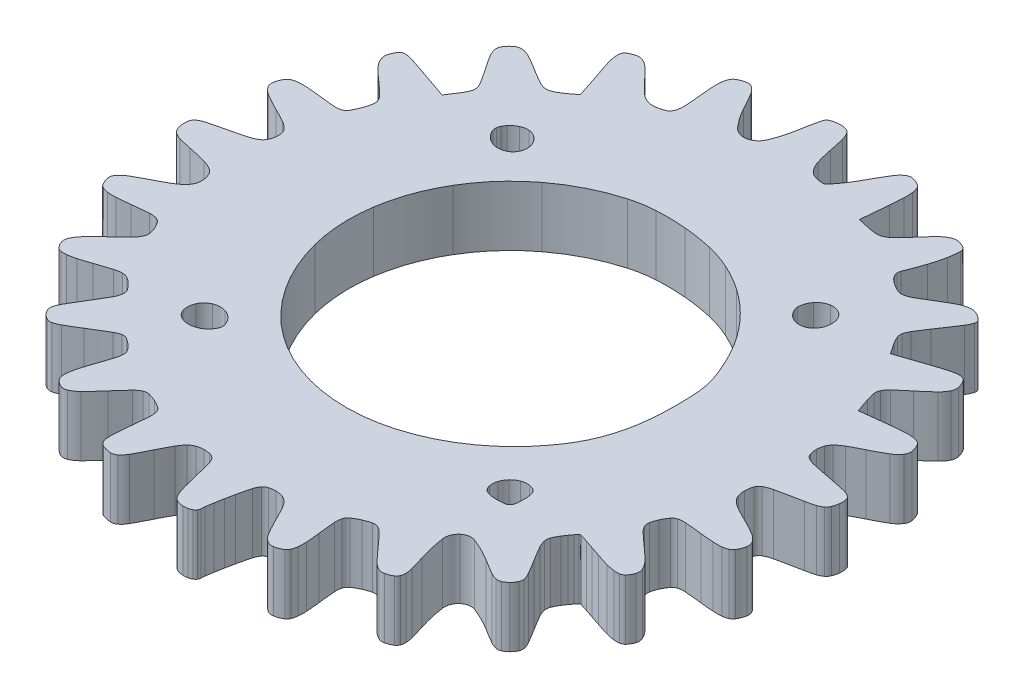
from build123d import *

# Parameters (mm, degrees)
BOSS_EXTRUDE1_DEPTH = 1
SCALE1_SCALE        = 2.27
SCALE2_SCALE        = 10


with BuildPart() as part:
    # Sketch1 → Boss-Extrude1 (new body)
    with BuildSketch(Plane(origin=(0, 0, 0), x_dir=(1, 0, 0), z_dir=(0, 1, 0))):
        with BuildLine():
            Line((11035.177669211, 9201.866790944), (11035.057855683, 9201.683932432))
            Line((11035.057855683, 9201.683932432), (11034.626065488, 9201.832489971))
            ThreePointArc((11034.626065488, 9201.832489971), (11034.448731234, 9201.892544533), (11034.270824441, 9201.950881149))
            ThreePointArc((11034.270824441, 9201.950881149), (11034.210556879, 9201.965043925), (11034.148792274, 9201.969274381))
            ThreePointArc((11034.148792274, 9201.969274381), (11034.109867467, 9201.959348395), (11034.079757284, 9201.932758122))
            ThreePointArc((11034.079757284, 9201.932758122), (11034.048985142, 9201.880804452), (11034.026412255, 9201.824799334))
            ThreePointArc((11034.026412255, 9201.824799334), (11034.017950195, 9201.779045136), (11034.021020038, 9201.732616384))
            ThreePointArc((11034.021020038, 9201.732616384), (11034.035379997, 9201.68363181), (11034.058704291, 9201.638226148))
            ThreePointArc((11034.058704291, 9201.638226148), (11034.101246113, 9201.57918784), (11034.150031591, 9201.525194269))
            ThreePointArc((11034.150031591, 9201.525194269), (11034.233485786, 9201.444903443), (11034.319274229, 9201.367111654))
            ThreePointArc((11034.319274229, 9201.367111654), (11034.424924938, 9201.272210614), (11034.528644855, 9201.175203097))
            ThreePointArc((11034.528644855, 9201.175203097), (11034.569364531, 9201.12854551), (11034.600943338, 9201.075274493))
            ThreePointArc((11034.600943338, 9201.075274493), (11034.615010663, 9201.02790222), (11034.613933686, 9200.97849714))
            ThreePointArc((11034.613933686, 9200.97849714), (11034.597141234, 9200.904446039), (11034.573620228, 9200.83224968))
            ThreePointArc((11034.573620228, 9200.83224968), (11034.543163619, 9200.759927247), (11034.507351298, 9200.690101628))
            ThreePointArc((11034.507351298, 9200.690101628), (11034.479051504, 9200.656142185), (11034.440464691, 9200.634574155))
            ThreePointArc((11034.440464691, 9200.634574155), (11034.386898194, 9200.622376539), (11034.331970064, 9200.62135094))
            ThreePointArc((11034.331970064, 9200.62135094), (11034.184748238, 9200.634910385), (11034.037759044, 9200.650794392))
            ThreePointArc((11034.037759044, 9200.650794392), (11033.926384526, 9200.662402746), (11033.814769041, 9200.671403901))
            ThreePointArc((11033.814769041, 9200.671403901), (11033.743563625, 9200.673286423), (11033.672454187, 9200.66913878))
            ThreePointArc((11033.672454187, 9200.66913878), (11033.625430439, 9200.660898955), (11033.580101463, 9200.645918582))
            ThreePointArc((11033.580101463, 9200.645918582), (11033.548535633, 9200.626758459), (11033.524236195, 9200.598954694))
            ThreePointArc((11033.524236195, 9200.598954694), (11033.490770858, 9200.532310943), (11033.471121671, 9200.460371887))
            ThreePointArc((11033.471121671, 9200.460371887), (11033.472769426, 9200.401432372), (11033.496724719, 9200.347555425))
            ThreePointArc((11033.496724719, 9200.347555425), (11033.55022757, 9200.286466615), (11033.615357603, 9200.23796428))
            ThreePointArc((11033.615357603, 9200.23796428), (11033.745586764, 9200.164297637), (11033.878603762, 9200.095792987))
            ThreePointArc((11033.878603762, 9200.095792987), (11033.995698245, 9200.036585968), (11034.111317038, 9199.974546595))
            ThreePointArc((11034.111317038, 9199.974546595), (11034.169621921, 9199.936796902), (11034.222095303, 9199.891288189))
            ThreePointArc((11034.222095303, 9199.891288189), (11034.252090004, 9199.852186517), (11034.270834728, 9199.806609568))
            ThreePointArc((11034.270834728, 9199.806609568), (11034.279908304, 9199.751957177), (11034.278653762, 9199.6965709))
            ThreePointArc((11034.278653762, 9199.6965709), (11034.266995154, 9199.641558569), (11034.245405111, 9199.589634106))
            ThreePointArc((11034.245405111, 9199.589634106), (11034.216626481, 9199.549542394), (11034.178139256, 9199.518650834))
            ThreePointArc((11034.178139256, 9199.518650834), (11034.115165178, 9199.486508748), (11034.048392069, 9199.463266541))
            ThreePointArc((11034.048392069, 9199.463266541), (11033.912700534, 9199.427767161), (11033.776287507, 9199.395149913))
            ThreePointArc((11033.776287507, 9199.395149913), (11033.631014278, 9199.360767777), (11033.48633081, 9199.323982771))
            ThreePointArc((11033.48633081, 9199.323982771), (11033.427304999, 9199.303138213), (11033.372487401, 9199.272912845))
            ThreePointArc((11033.372487401, 9199.272912845), (11033.342113111, 9199.243059754), (11033.325027678, 9199.204048314))
            ThreePointArc((11033.325027678, 9199.204048314), (11033.317283863, 9199.148072799), (11033.319087507, 9199.091592964))
            ThreePointArc((11033.319087507, 9199.091592964), (11033.32964109, 9199.037730735), (11033.348317904, 9198.986119743))
            ThreePointArc((11033.348317904, 9198.986119743), (11033.372252283, 9198.948173269), (11033.405659699, 9198.918227753))
            ThreePointArc((11033.405659699, 9198.918227753), (11033.457107079, 9198.889468735), (11033.512577291, 9198.86954464))
            ThreePointArc((11033.512577291, 9198.86954464), (11033.617322277, 9198.843141764), (11033.722833665, 9198.819990713))
            ThreePointArc((11033.722833665, 9198.819990713), (11033.878420938, 9198.785925228), (11034.032915239, 9198.747203558))
            ThreePointArc((11034.032915239, 9198.747203558), (11034.114043101, 9198.718283798), (11034.189374337, 9198.676531106))
            ThreePointArc((11034.189374337, 9198.676531106), (11034.235371669, 9198.634675882), (11034.266908675, 9198.581075214))
            ThreePointArc((11034.266908675, 9198.581075214), (11034.287414648, 9198.511370037), (11034.294333665, 9198.439041386))
            ThreePointArc((11034.294333665, 9198.439041386), (11034.288684052, 9198.387985439), (11034.272008512, 9198.339399904))
            ThreePointArc((11034.272008512, 9198.339399904), (11034.244401044, 9198.292836978), (11034.208548619, 9198.252279834))
            ThreePointArc((11034.208548619, 9198.252279834), (11034.150593798, 9198.203821622), (11034.087574032, 9198.162162666))
            ThreePointArc((11034.087574032, 9198.162162666), (11033.98225956, 9198.102818548), (11033.875233665, 9198.046619615))
            ThreePointArc((11033.875233665, 9198.046619615), (11033.739836207, 9197.975524812), (11033.606602147, 9197.900453995))
            ThreePointArc((11033.606602147, 9197.900453995), (11033.546175806, 9197.856353493), (11033.495997695, 9197.800870577))
            ThreePointArc((11033.495997695, 9197.800870577), (11033.474163269, 9197.752680404), (11033.47358697, 9197.699777637))
            ThreePointArc((11033.47358697, 9197.699777637), (11033.493585521, 9197.632369022), (11033.525584097, 9197.569759482))
            ThreePointArc((11033.525584097, 9197.569759482), (11033.550300375, 9197.541269714), (11033.582335495, 9197.521362119))
            ThreePointArc((11033.582335495, 9197.521362119), (11033.627583563, 9197.505823562), (11033.674648214, 9197.497235599))
            ThreePointArc((11033.674648214, 9197.497235599), (11033.746050999, 9197.492780333), (11033.817572515, 9197.494477387))
            ThreePointArc((11033.817572515, 9197.494477387), (11033.931176477, 9197.503381891), (11034.044546102, 9197.514891824))
            ThreePointArc((11034.044546102, 9197.514891824), (11034.185513096, 9197.529632152), (11034.326709597, 9197.541981991))
            ThreePointArc((11034.326709597, 9197.541981991), (11034.386197718, 9197.541679886), (11034.444800852, 9197.531452447))
            ThreePointArc((11034.444800852, 9197.531452447), (11034.485421727, 9197.513280642), (11034.518021889, 9197.48299039))
            ThreePointArc((11034.518021889, 9197.48299039), (11034.554280834, 9197.430042207), (11034.584208523, 9197.373274658))
            ThreePointArc((11034.584208523, 9197.373274658), (11034.606146493, 9197.314794414), (11034.619875457, 9197.253862247))
            ThreePointArc((11034.619875457, 9197.253862247), (11034.619823798, 9197.206628842), (11034.605449197, 9197.161635863))
            ThreePointArc((11034.605449197, 9197.161635863), (11034.572291369, 9197.106799411), (11034.53076832, 9197.057990452))
            ThreePointArc((11034.53076832, 9197.057990452), (11034.431749273, 9196.960973125), (11034.330779667, 9196.865987483))
            ThreePointArc((11034.330779667, 9196.865987483), (11034.218274651, 9196.758936563), (11034.109219252, 9196.648373466))
            ThreePointArc((11034.109219252, 9196.648373466), (11034.056578625, 9196.582817939), (11034.015952509, 9196.50921032))
            ThreePointArc((11034.015952509, 9196.50921032), (11034.002391585, 9196.454084678), (11034.008780108, 9196.397676152))
            ThreePointArc((11034.008780108, 9196.397676152), (11034.034584729, 9196.338896641), (11034.074018891, 9196.28824236))
            ThreePointArc((11034.074018891, 9196.28824236), (11034.103046331, 9196.267331449), (11034.137202026, 9196.256689693))
            ThreePointArc((11034.137202026, 9196.256689693), (11034.186046996, 9196.25298533), (11034.234958853, 9196.255665565))
            ThreePointArc((11034.234958853, 9196.255665565), (11034.30605419, 9196.267156425), (11034.375994309, 9196.284331014))
            ThreePointArc((11034.375994309, 9196.284331014), (11034.479436795, 9196.315610967), (11034.58206014, 9196.349481785))
            ThreePointArc((11034.58206014, 9196.349481785), (11034.710989034, 9196.392670951), (11034.84060293, 9196.433758681))
            ThreePointArc((11034.84060293, 9196.433758681), (11034.901107304, 9196.448098927), (11034.962974415, 9196.454334509))
            ThreePointArc((11034.962974415, 9196.454334509), (11035.008190423, 9196.450067901), (11035.050840102, 9196.43445713))
            ThreePointArc((11035.050840102, 9196.43445713), (11035.100163246, 9196.404666497), (11035.145274914, 9196.368816926))
            ThreePointArc((11035.145274914, 9196.368816926), (11035.199455249, 9196.313813751), (11035.246982102, 9196.252969228))
            ThreePointArc((11035.246982102, 9196.252969228), (11035.267389768, 9196.206766744), (11035.269222291, 9196.156291163))
            ThreePointArc((11035.269222291, 9196.156291163), (11035.252643728, 9196.090021541), (11035.22426894, 9196.027881514))
            ThreePointArc((11035.22426894, 9196.027881514), (11035.136355303, 9195.877100942), (11035.046067467, 9195.727729943))
            ThreePointArc((11035.046067467, 9195.727729943), (11034.975871675, 9195.611451743), (11034.907656035, 9195.494000921))
            ThreePointArc((11034.907656035, 9195.494000921), (11034.881564429, 9195.439269489), (11034.863696712, 9195.381329467))
            ThreePointArc((11034.863696712, 9195.381329467), (11034.861076174, 9195.340263478), (11034.871709066, 9195.300511442))
            ThreePointArc((11034.871709066, 9195.300511442), (11034.896477063, 9195.256673504), (11034.928722058, 9195.218002082))
            ThreePointArc((11034.928722058, 9195.218002082), (11034.967397437, 9195.185801276), (11035.01126708, 9195.161140957))
            ThreePointArc((11035.01126708, 9195.161140957), (11035.051095995, 9195.15063584), (11035.092190794, 9195.153449633))
            ThreePointArc((11035.092190794, 9195.153449633), (11035.150247323, 9195.171678315), (11035.205047718, 9195.198131332))
            ThreePointArc((11035.205047718, 9195.198131332), (11035.322790381, 9195.267260745), (11035.439351441, 9195.338364402))
            ThreePointArc((11035.439351441, 9195.338364402), (11035.589385223, 9195.430537569), (11035.740382512, 9195.521123701))
            ThreePointArc((11035.740382512, 9195.521123701), (11035.793796237, 9195.54693133), (11035.850806142, 9195.563330424))
            ThreePointArc((11035.850806142, 9195.563330424), (11035.895098279, 9195.563691916), (11035.936462943, 9195.547852451))
            ThreePointArc((11035.936462943, 9195.547852451), (11035.997124667, 9195.506497236), (11036.053755393, 9195.459774014))
            ThreePointArc((11036.053755393, 9195.459774014), (11036.091998454, 9195.420171005), (11036.124580931, 9195.375794071))
            ThreePointArc((11036.124580931, 9195.375794071), (11036.141658802, 9195.337408436), (11036.146845733, 9195.295716634))
            ThreePointArc((11036.146845733, 9195.295716634), (11036.141349451, 9195.237045424), (11036.12774666, 9195.179708839))
            ThreePointArc((11036.12774666, 9195.179708839), (11036.085258143, 9195.047008418), (11036.040872488, 9194.914930451))
            ThreePointArc((11036.040872488, 9194.914930451), (11036.006137667, 9194.809695354), (11035.974055832, 9194.703621374))
            ThreePointArc((11035.974055832, 9194.703621374), (11035.956767931, 9194.632819882), (11035.945431912, 9194.560825317))
            ThreePointArc((11035.945431912, 9194.560825317), (11035.943069671, 9194.51032961), (11035.947552253, 9194.459977817))
            ThreePointArc((11035.947552253, 9194.459977817), (11035.959018604, 9194.421637571), (11035.980231004, 9194.387704022))
            ThreePointArc((11035.980231004, 9194.387704022), (11036.028260179, 9194.342085796), (11036.085651647, 9194.309009463))
            ThreePointArc((11036.085651647, 9194.309009463), (11036.13933231, 9194.298120739), (11036.192920444, 9194.309456071))
            ThreePointArc((11036.192920444, 9194.309456071), (11036.264503078, 9194.349260493), (11036.327307297, 9194.40183516))
            ThreePointArc((11036.327307297, 9194.40183516), (11036.4367903, 9194.51622857), (11036.542647583, 9194.633985166))
            ThreePointArc((11036.542647583, 9194.633985166), (11036.63969835, 9194.743382054), (11036.738712926, 9194.851004747))
            ThreePointArc((11036.738712926, 9194.851004747), (11036.783951053, 9194.891110578), (11036.835803842, 9194.922195206))
            ThreePointArc((11036.835803842, 9194.922195206), (11036.881013281, 9194.935083664), (11036.927934747, 9194.932188532))
            ThreePointArc((11036.927934747, 9194.932188532), (11036.998051757, 9194.91199933), (11037.065853852, 9194.885038715))
            ThreePointArc((11037.065853852, 9194.885038715), (11037.132121863, 9194.851156117), (11037.19506703, 9194.811439802))
            ThreePointArc((11037.19506703, 9194.811439802), (11037.228310008, 9194.778797379), (11037.248907435, 9194.737007794))
            ThreePointArc((11037.248907435, 9194.737007794), (11037.260763333, 9194.678388317), (11037.261922243, 9194.618593147))
            ThreePointArc((11037.261922243, 9194.618593147), (11037.249976786, 9194.466847935), (11037.23565176, 9194.315308841))
            ThreePointArc((11037.23565176, 9194.315308841), (11037.223839833, 9194.188440282), (11037.214379844, 9194.061374703))
            ThreePointArc((11037.214379844, 9194.061374703), (11037.213460311, 9193.993046244), (11037.219583999, 9193.924986533))
            ThreePointArc((11037.219583999, 9193.924986533), (11037.230306719, 9193.88355221), (11037.249958233, 9193.845531193))
            ThreePointArc((11037.249958233, 9193.845531193), (11037.275920849, 9193.817257324), (11037.30922766, 9193.798175255))
            ThreePointArc((11037.30922766, 9193.798175255), (11037.379289477, 9193.776696017), (11037.451638297, 9193.765048524))
            ThreePointArc((11037.451638297, 9193.765048524), (11037.502652916, 9193.770155123), (11037.54811245, 9193.793861649))
            ThreePointArc((11037.54811245, 9193.793861649), (11037.597691616, 9193.841960239), (11037.636830282, 9193.898878889))
            ThreePointArc((11037.636830282, 9193.898878889), (11037.709089358, 9194.033877629), (11037.778135409, 9194.170547586))
            ThreePointArc((11037.778135409, 9194.170547586), (11037.835886138, 9194.284335393), (11037.896727908, 9194.396500855))
            ThreePointArc((11037.896727908, 9194.396500855), (11037.936278516, 9194.457314433), (11037.983482141, 9194.512399455))
            ThreePointArc((11037.983482141, 9194.512399455), (11038.024927924, 9194.546125025), (11038.072891335, 9194.569676633))
            ThreePointArc((11038.072891335, 9194.569676633), (11038.12966035, 9194.584617922), (11038.188146807, 9194.589647586))
            ThreePointArc((11038.188146807, 9194.589647586), (11038.240275167, 9194.5870264), (11038.291877638, 9194.579189212))
            ThreePointArc((11038.291877638, 9194.579189212), (11038.328358812, 9194.566991558), (11038.360824846, 9194.546361109))
            ThreePointArc((11038.360824846, 9194.546361109), (11038.388090503, 9194.518016517), (11038.408039661, 9194.484121635))
            ThreePointArc((11038.408039661, 9194.484121635), (11038.42793445, 9194.432892725), (11038.44319476, 9194.380097586))
            ThreePointArc((11038.44319476, 9194.380097586), (11038.503887514, 9194.133084826), (11038.566593345, 9193.886575408))
            ThreePointArc((11038.566593345, 9193.886575408), (11038.595275406, 9193.795513672), (11038.633249752, 9193.707918869))
            ThreePointArc((11038.633249752, 9193.707918869), (11038.666017537, 9193.661891545), (11038.711442991, 9193.628294365))
            ThreePointArc((11038.711442991, 9193.628294365), (11038.769546652, 9193.606465222), (11038.831170717, 9193.599047586))
            ThreePointArc((11038.831170717, 9193.599047586), (11038.869610767, 9193.600932534), (11038.907681994, 9193.606569212))
            ThreePointArc((11038.907681994, 9193.606569212), (11038.938482048, 9193.615430405), (11038.967362596, 9193.629325656))
            ThreePointArc((11038.967362596, 9193.629325656), (11038.988206268, 9193.644975532), (11039.005075196, 9193.664845524))
            ThreePointArc((11039.005075196, 9193.664845524), (11039.01524302, 9193.686202272), (11039.018733665, 9193.709596946))
            ThreePointArc((11039.018733665, 9193.709596946), (11039.01989066, 9193.742004482), (11039.023355728, 9193.774247007))
            ThreePointArc((11039.023355728, 9193.774247007), (11039.032810926, 9193.837524726), (11039.042972199, 9193.900692906))
            ThreePointArc((11039.042972199, 9193.900692906), (11039.05585407, 9193.975171952), (11039.069656524, 9194.049485903))
            ThreePointArc((11039.069656524, 9194.049485903), (11039.085035789, 9194.127276073), (11039.101247901, 9194.204896946))
            ThreePointArc((11039.101247901, 9194.204896946), (11039.126839305, 9194.316973428), (11039.155386554, 9194.42833371))
            ThreePointArc((11039.155386554, 9194.42833371), (11039.174862623, 9194.480208818), (11039.203783612, 9194.527473187))
            ThreePointArc((11039.203783612, 9194.527473187), (11039.234609238, 9194.556772348), (11039.273325027, 9194.574372001))
            ThreePointArc((11039.273325027, 9194.574372001), (11039.33125242, 9194.585812528), (11039.39017407, 9194.589647586))
            ThreePointArc((11039.39017407, 9194.589647586), (11039.449280842, 9194.584663153), (11039.50671816, 9194.569850674))
            ThreePointArc((11039.50671816, 9194.569850674), (11039.554840995, 9194.546551872), (11039.596427505, 9194.512948247))
            ThreePointArc((11039.596427505, 9194.512948247), (11039.643621566, 9194.458064137), (11039.683108815, 9194.397398644))
            ThreePointArc((11039.683108815, 9194.397398644), (11039.744163976, 9194.284783007), (11039.80213192, 9194.170547586))
            ThreePointArc((11039.80213192, 9194.170547586), (11039.870133486, 9194.038580951), (11039.943314366, 9193.909414529))
            ThreePointArc((11039.943314366, 9193.909414529), (11039.991659912, 9193.844686232), (11040.05256543, 9193.791605519))
            ThreePointArc((11040.05256543, 9193.791605519), (11040.106392973, 9193.767846821), (11040.16521128, 9193.766334551))
            ThreePointArc((11040.16521128, 9193.766334551), (11040.237065226, 9193.786076993), (11040.303640772, 9193.819550117))
            ThreePointArc((11040.303640772, 9193.819550117), (11040.331502783, 9193.843925252), (11040.35066364, 9193.87560017))
            ThreePointArc((11040.35066364, 9193.87560017), (11040.365620353, 9193.921149982), (11040.373814571, 9193.968387081))
            ThreePointArc((11040.373814571, 9193.968387081), (11040.377891689, 9194.039976806), (11040.375931179, 9194.11165573))
            ThreePointArc((11040.375931179, 9194.11165573), (11040.366779748, 9194.224412554), (11040.355032948, 9194.33692861))
            ThreePointArc((11040.355032948, 9194.33692861), (11040.339447074, 9194.481723918), (11040.326271715, 9194.626758434))
            ThreePointArc((11040.326271715, 9194.626758434), (11040.326867295, 9194.684778707), (11040.338130111, 9194.741698438))
            ThreePointArc((11040.338130111, 9194.741698438), (11040.358232482, 9194.782600507), (11040.390755127, 9194.814527959))
            ThreePointArc((11040.390755127, 9194.814527959), (11040.452724253, 9194.853612054), (11040.517925916, 9194.887025858))
            ThreePointArc((11040.517925916, 9194.887025858), (11040.584742815, 9194.913561896), (11040.653913275, 9194.933160539))
            ThreePointArc((11040.653913275, 9194.933160539), (11040.700988348, 9194.935841318), (11040.746308518, 9194.922828581))
            ThreePointArc((11040.746308518, 9194.922828581), (11040.798723535, 9194.891491499), (11040.844601336, 9194.851185493))
            ThreePointArc((11040.844601336, 9194.851185493), (11040.944358954, 9194.744079312), (11041.042156542, 9194.635180515))
            ThreePointArc((11041.042156542, 9194.635180515), (11041.146891628, 9194.519087789), (11041.254233334, 9194.405400863))
            ThreePointArc((11041.254233334, 9194.405400863), (11041.310513248, 9194.356047396), (11041.374161466, 9194.316650723))
            ThreePointArc((11041.374161466, 9194.316650723), (11041.424305439, 9194.301035468), (11041.476788235, 9194.302987453))
            ThreePointArc((11041.476788235, 9194.302987453), (11041.53938764, 9194.322095131), (11041.597581999, 9194.352048518))
            ThreePointArc((11041.597581999, 9194.352048518), (11041.624333466, 9194.3755566), (11041.642573604, 9194.40614366))
            ThreePointArc((11041.642573604, 9194.40614366), (11041.653271014, 9194.444700029), (11041.655215031, 9194.484665627))
            ThreePointArc((11041.655215031, 9194.484665627), (11041.647955654, 9194.548184242), (11041.634219036, 9194.61062316))
            ThreePointArc((11041.634219036, 9194.61062316), (11041.601780922, 9194.724593233), (11041.567215385, 9194.837936218))
            ThreePointArc((11041.567215385, 9194.837936218), (11041.506732058, 9195.060002397), (11041.463938172, 9195.286144618))
            ThreePointArc((11041.463938172, 9195.286144618), (11041.475562914, 9195.40153403), (11041.540698395, 9195.49748829))
            ThreePointArc((11041.540698395, 9195.49748829), (11041.640030214, 9195.545684679), (11041.749911057, 9195.534918873))
            ThreePointArc((11041.749911057, 9195.534918873), (11041.946756142, 9195.447409356), (11042.134739421, 9195.342203891))
            ThreePointArc((11042.134739421, 9195.342203891), (11042.254571324, 9195.269041496), (11042.375564111, 9195.197815331))
            ThreePointArc((11042.375564111, 9195.197815331), (11042.430435674, 9195.171291025), (11042.488609402, 9195.153118392))
            ThreePointArc((11042.488609402, 9195.153118392), (11042.529976495, 9195.150538337), (11042.569909011, 9195.161641819))
            ThreePointArc((11042.569909011, 9195.161641819), (11042.614820916, 9195.187644604), (11042.654562258, 9195.221018993))
            ThreePointArc((11042.654562258, 9195.221018993), (11042.687947863, 9195.260734827), (11042.714009307, 9195.305598478))
            ThreePointArc((11042.714009307, 9195.305598478), (11042.725156241, 9195.345411641), (11042.722644596, 9195.386679469))
            ThreePointArc((11042.722644596, 9195.386679469), (11042.704611554, 9195.444622848), (11042.678226777, 9195.499271446))
            ThreePointArc((11042.678226777, 9195.499271446), (11042.60736475, 9195.619681731), (11042.534565317, 9195.738930657))
            ThreePointArc((11042.534565317, 9195.738930657), (11042.460659779, 9195.860222821), (11042.388932868, 9195.98281592))
            ThreePointArc((11042.388932868, 9195.98281592), (11042.361591026, 9196.040261258), (11042.343288382, 9196.10119201))
            ThreePointArc((11042.343288382, 9196.10119201), (11042.339743841, 9196.149100856), (11042.349741455, 9196.196088823))
            ThreePointArc((11042.349741455, 9196.196088823), (11042.375881468, 9196.256470478), (11042.408738848, 9196.313476066))
            ThreePointArc((11042.408738848, 9196.313476066), (11042.432062965, 9196.348398432), (11042.455998469, 9196.382904629))
            ThreePointArc((11042.455998469, 9196.382904629), (11042.477483042, 9196.412458257), (11042.499748089, 9196.441428439))
            ThreePointArc((11042.499748089, 9196.441428439), (11042.518631578, 9196.46494314), (11042.537888628, 9196.488152908))
            ThreePointArc((11042.537888628, 9196.488152908), (11042.54415708, 9196.492944579), (11042.551861193, 9196.494647586))
            ThreePointArc((11042.551861193, 9196.494647586), (11042.561051578, 9196.493930977), (11042.570019806, 9196.491798468))
            ThreePointArc((11042.570019806, 9196.491798468), (11042.631668261, 9196.471910205), (11042.693284736, 9196.451923084))
            ThreePointArc((11042.693284736, 9196.451923084), (11042.764316114, 9196.428617471), (11042.835227048, 9196.404947918))
            ThreePointArc((11042.835227048, 9196.404947918), (11042.917169391, 9196.377211004), (11042.999019252, 9196.34920236))
            ThreePointArc((11042.999019252, 9196.34920236), (11043.101448016, 9196.315398664), (11043.204695854, 9196.284186082))
            ThreePointArc((11043.204695854, 9196.284186082), (11043.274516861, 9196.267052845), (11043.345491585, 9196.255602547))
            ThreePointArc((11043.345491585, 9196.255602547), (11043.394333283, 9196.25294836), (11043.443104547, 9196.256679329))
            ThreePointArc((11043.443104547, 9196.256679329), (11043.477238401, 9196.267335581), (11043.506248439, 9196.28824236))
            ThreePointArc((11043.506248439, 9196.28824236), (11043.546157393, 9196.339651353), (11043.572074113, 9196.399350037))
            ThreePointArc((11043.572074113, 9196.399350037), (11043.578215207, 9196.456717405), (11043.564015582, 9196.512637873))
            ThreePointArc((11043.564015582, 9196.512637873), (11043.522302047, 9196.586388126), (11043.468264948, 9196.65164999))
            ThreePointArc((11043.468264948, 9196.65164999), (11043.358906259, 9196.758445539), (11043.245928665, 9196.86140512))
            ThreePointArc((11043.245928665, 9196.86140512), (11043.141860735, 9196.954843412), (11043.039652217, 9197.050312083))
            ThreePointArc((11043.039652217, 9197.050312083), (11042.998594745, 9197.096776862), (11042.966089651, 9197.149579423))
            ThreePointArc((11042.966089651, 9197.149579423), (11042.952158644, 9197.194055213), (11042.953141671, 9197.240651377))
            ThreePointArc((11042.953141671, 9197.240651377), (11042.969007481, 9197.304259894), (11042.992499809, 9197.365463472))
            ThreePointArc((11042.992499809, 9197.365463472), (11043.023563563, 9197.42509709), (11043.060729594, 9197.48113111))
            ThreePointArc((11043.060729594, 9197.48113111), (11043.093069474, 9197.512267293), (11043.133791678, 9197.531162582))
            ThreePointArc((11043.133791678, 9197.531162582), (11043.191804147, 9197.541813974), (11043.25078451, 9197.542278333))
            ThreePointArc((11043.25078451, 9197.542278333), (11043.393368152, 9197.52978452), (11043.535721227, 9197.514891824))
            ThreePointArc((11043.535721227, 9197.514891824), (11043.649090852, 9197.503381891), (11043.762694814, 9197.494477387))
            ThreePointArc((11043.762694814, 9197.494477387), (11043.83421633, 9197.492780333), (11043.905619116, 9197.497235599))
            ThreePointArc((11043.905619116, 9197.497235599), (11043.952683766, 9197.505823562), (11043.997931834, 9197.521362119))
            ThreePointArc((11043.997931834, 9197.521362119), (11044.029966955, 9197.541269714), (11044.054683232, 9197.569759482))
            ThreePointArc((11044.054683232, 9197.569759482), (11044.08863074, 9197.637007255), (11044.10897436, 9197.709538857))
            ThreePointArc((11044.10897436, 9197.709538857), (11044.107831382, 9197.768521122), (11044.084262167, 9197.822601674))
            ThreePointArc((11044.084262167, 9197.822601674), (11044.031430794, 9197.883573502), (11043.966838272, 9197.931911107))
            ThreePointArc((11043.966838272, 9197.931911107), (11043.837338895, 9198.005275226), (11043.705033665, 9198.073449331))
            ThreePointArc((11043.705033665, 9198.073449331), (11043.589709384, 9198.131945455), (11043.475999096, 9198.193520261))
            ThreePointArc((11043.475999096, 9198.193520261), (11043.415696774, 9198.232853866), (11043.361306133, 9198.280025473))
            ThreePointArc((11043.361306133, 9198.280025473), (11043.327992226, 9198.321967975), (11043.305300276, 9198.370486684))
            ThreePointArc((11043.305300276, 9198.370486684), (11043.290806546, 9198.429600416), (11043.285933665, 9198.490269655))
            ThreePointArc((11043.285933665, 9198.490269655), (11043.291138056, 9198.559110381), (11043.306632861, 9198.626386249))
            ThreePointArc((11043.306632861, 9198.626386249), (11043.330222199, 9198.670088293), (11043.368537513, 9198.701683583))
            ThreePointArc((11043.368537513, 9198.701683583), (11043.436899357, 9198.732659416), (11043.508956663, 9198.753649621))
            ThreePointArc((11043.508956663, 9198.753649621), (11043.721091012, 9198.79837516), (11043.933633665, 9198.841118306))
            ThreePointArc((11043.933633665, 9198.841118306), (11044.014899225, 9198.859047909), (11044.095238625, 9198.880753736))
            ThreePointArc((11044.095238625, 9198.880753736), (11044.142295619, 9198.899634395), (11044.184976926, 9198.927004926))
            ThreePointArc((11044.184976926, 9198.927004926), (11044.21457486, 9198.95724964), (11044.235280051, 9198.994155947))
            ThreePointArc((11044.235280051, 9198.994155947), (11044.251872616, 9199.045251945), (11044.261636869, 9199.098079717))
            ThreePointArc((11044.261636869, 9199.098079717), (11044.263694143, 9199.155841382), (11044.256344246, 9199.213170445))
            ThreePointArc((11044.256344246, 9199.213170445), (11044.239535945, 9199.25160827), (11044.208904031, 9199.280273079))
            ThreePointArc((11044.208904031, 9199.280273079), (11044.153318268, 9199.30821387), (11044.093868777, 9199.326550253))
            ThreePointArc((11044.093868777, 9199.326550253), (11043.939858937, 9199.359140308), (11043.785386869, 9199.389463945))
            ThreePointArc((11043.785386869, 9199.389463945), (11043.633114516, 9199.41947673), (11043.481349098, 9199.45195587))
            ThreePointArc((11043.481349098, 9199.45195587), (11043.418947055, 9199.471178308), (11043.360397524, 9199.500082799))
            ThreePointArc((11043.360397524, 9199.500082799), (11043.326318165, 9199.529813931), (11043.304810005, 9199.569597621))
            ThreePointArc((11043.304810005, 9199.569597621), (11043.290682432, 9199.627950927), (11043.285933665, 9199.687801957))
            ThreePointArc((11043.285933665, 9199.687801957), (11043.29097192, 9199.746171636), (11043.305937612, 9199.802814655))
            ThreePointArc((11043.305937612, 9199.802814655), (11043.329537584, 9199.850747868), (11043.363286571, 9199.892167156))
            ThreePointArc((11043.363286571, 9199.892167156), (11043.418409781, 9199.939372677), (11043.479251541, 9199.97893541))
            ThreePointArc((11043.479251541, 9199.97893541), (11043.591331221, 9200.039736443), (11043.705033665, 9200.097445841))
            ThreePointArc((11043.705033665, 9200.097445841), (11043.837000299, 9200.165447408), (11043.966166721, 9200.238628287))
            ThreePointArc((11043.966166721, 9200.238628287), (11044.030895018, 9200.286973833), (11044.083975731, 9200.347879351))
            ThreePointArc((11044.083975731, 9200.347879351), (11044.10773443, 9200.401706895), (11044.109246699, 9200.460525202))
            ThreePointArc((11044.109246699, 9200.460525202), (11044.089504258, 9200.532379147), (11044.056031134, 9200.598954694))
            ThreePointArc((11044.056031134, 9200.598954694), (11044.031554885, 9200.626894208), (11043.999734193, 9200.646055285))
            ThreePointArc((11043.999734193, 9200.646055285), (11043.953887185, 9200.660979944), (11043.906363056, 9200.669113253))
            ThreePointArc((11043.906363056, 9200.669113253), (11043.834128124, 9200.673095929), (11043.761812952, 9200.671031207))
            ThreePointArc((11043.761812952, 9200.671031207), (11043.6475208, 9200.661678153), (11043.533469136, 9200.64974527))
            Line((11043.533469136, 9200.64974527), (11043.076675968, 9200.596728815))
            Line((11043.076675968, 9200.596728815), (11042.995271279, 9200.830246535))
            ThreePointArc((11042.995271279, 9200.830246535), (11042.973941699, 9200.901840164), (11042.959261598, 9200.975086961))
            ThreePointArc((11042.959261598, 9200.975086961), (11042.959388078, 9201.023750692), (11042.974309574, 9201.07007049))
            ThreePointArc((11042.974309574, 9201.07007049), (11043.006364491, 9201.121227157), (11043.04737882, 9201.165525544))
            ThreePointArc((11043.04737882, 9201.165525544), (11043.148877934, 9201.254427707), (11043.252300128, 9201.341085163))
            ThreePointArc((11043.252300128, 9201.341085163), (11043.362379858, 9201.434342662), (11043.469345464, 9201.531156233))
            ThreePointArc((11043.469345464, 9201.531156233), (11043.52065565, 9201.588815962), (11043.560603194, 9201.65485817))
            ThreePointArc((11043.560603194, 9201.65485817), (11043.57673746, 9201.709384359), (11043.574365371, 9201.766198028))
            ThreePointArc((11043.574365371, 9201.766198028), (11043.553908843, 9201.8332829), (11043.521829891, 9201.895651084))
            ThreePointArc((11043.521829891, 9201.895651084), (11043.497080203, 9201.923246711), (11043.46467029, 9201.941237353))
            ThreePointArc((11043.46467029, 9201.941237353), (11043.42301603, 9201.951018584), (11043.380231546, 9201.951506065))
            ThreePointArc((11043.380231546, 9201.951506065), (11043.310801884, 9201.941240617), (11043.242694813, 9201.924291159))
            ThreePointArc((11043.242694813, 9201.924291159), (11043.115187439, 9201.884740569), (11042.988354377, 9201.84307819))
            Line((11042.988354377, 9201.84307819), (11042.521448859, 9201.685401721))
            Line((11042.521448859, 9201.685401721), (11042.402116763, 9201.867525588))
            ThreePointArc((11042.402116763, 9201.867525588), (11042.368837444, 9201.924070626), (11042.341141447, 9201.983549918))
            ThreePointArc((11042.341141447, 9201.983549918), (11042.330539305, 9202.026662261), (11042.332846848, 9202.070999095))
            ThreePointArc((11042.332846848, 9202.070999095), (11042.348559739, 9202.124275344), (11042.373381667, 9202.173965641))
            ThreePointArc((11042.373381667, 9202.173965641), (11042.437923368, 9202.276351021), (11042.504691564, 9202.377298559))
            ThreePointArc((11042.504691564, 9202.377298559), (11042.617147532, 9202.544799589), (11042.7282424, 9202.713206447))
            ThreePointArc((11042.7282424, 9202.713206447), (11042.75904493, 9202.769049506), (11042.781152327, 9202.828870122))
            ThreePointArc((11042.781152327, 9202.828870122), (11042.782185427, 9202.867736475), (11042.764293611, 9202.902255218))
            ThreePointArc((11042.764293611, 9202.902255218), (11042.722767144, 9202.941175055), (11042.675117132, 9202.972298639))
            ThreePointArc((11042.675117132, 9202.972298639), (11042.627057087, 9202.992607195), (11042.576101785, 9203.003821588))
            ThreePointArc((11042.576101785, 9203.003821588), (11042.525275802, 9203.005150697), (11042.475179609, 9202.996466307))
            ThreePointArc((11042.475179609, 9202.996466307), (11042.408685931, 9202.973839397), (11042.345224853, 9202.943738269))
            ThreePointArc((11042.345224853, 9202.943738269), (11042.240663377, 9202.884816174), (11042.137645918, 9202.82323437))
            ThreePointArc((11042.137645918, 9202.82323437), (11042.018137363, 9202.751168157), (11041.897356533, 9202.681255177))
            ThreePointArc((11041.897356533, 9202.681255177), (11041.842477625, 9202.655869478), (11041.784174616, 9202.639841773))
            ThreePointArc((11041.784174616, 9202.639841773), (11041.736678433, 9202.637896556), (11041.69060574, 9202.649600326))
            ThreePointArc((11041.69060574, 9202.649600326), (11041.626595409, 9202.679752429), (11041.565669439, 9202.715731562))
            ThreePointArc((11041.565669439, 9202.715731562), (11041.523861652, 9202.745483826), (11041.484463709, 9202.778360723))
            ThreePointArc((11041.484463709, 9202.778360723), (11041.4567581, 9202.807593273), (11041.433952863, 9202.840790621))
            ThreePointArc((11041.433952863, 9202.840790621), (11041.420643403, 9202.870691671), (11041.413846807, 9202.902707617))
            ThreePointArc((11041.413846807, 9202.902707617), (11041.414387213, 9202.933812307), (11041.422411153, 9202.96386909))
            ThreePointArc((11041.422411153, 9202.96386909), (11041.484183269, 9203.124688519), (11041.540812695, 9203.287390058))
            ThreePointArc((11041.540812695, 9203.287390058), (11041.579118995, 9203.41729303), (11041.608961936, 9203.549397358))
            ThreePointArc((11041.608961936, 9203.549397358), (11041.623665659, 9203.645881821), (11041.630874313, 9203.743213658))
            ThreePointArc((11041.630874313, 9203.743213658), (11041.620238324, 9203.789743151), (11041.587888597, 9203.824837498))
            ThreePointArc((11041.587888597, 9203.824837498), (11041.529167912, 9203.854550936), (11041.46579829, 9203.872307583))
            ThreePointArc((11041.46579829, 9203.872307583), (11041.409364867, 9203.873587499), (11041.355164272, 9203.857818382))
            ThreePointArc((11041.355164272, 9203.857818382), (11041.289038294, 9203.819590781), (11041.230640899, 9203.770359298))
            ThreePointArc((11041.230640899, 9203.770359298), (11041.138242813, 9203.67385197), (11041.049491478, 9203.573980697))
            ThreePointArc((11041.049491478, 9203.573980697), (11040.972327306, 9203.486580852), (11040.892519325, 9203.401588331))
            ThreePointArc((11040.892519325, 9203.401588331), (11040.843973437, 9203.358730038), (11040.789340106, 9203.323963163))
            ThreePointArc((11040.789340106, 9203.323963163), (11040.740623964, 9203.305076788), (11040.688833525, 9203.298169691))
            ThreePointArc((11040.688833525, 9203.298169691), (11040.621966592, 9203.301085943), (11040.555876793, 9203.311660901))
            Line((11040.555876793, 9203.311660901), (11040.329379761, 9203.361407995))
            Line((11040.329379761, 9203.361407995), (11040.371127988, 9203.821814644))
            ThreePointArc((11040.371127988, 9203.821814644), (11040.380102982, 9203.935705216), (11040.386390772, 9204.049775707))
            ThreePointArc((11040.386390772, 9204.049775707), (11040.386533027, 9204.123345154), (11040.380598353, 9204.196674981))
            ThreePointArc((11040.380598353, 9204.196674981), (11040.371131527, 9204.245416349), (11040.354980522, 9204.292368313))
            ThreePointArc((11040.354980522, 9204.292368313), (11040.335036492, 9204.324725422), (11040.30635494, 9204.349667665))
            ThreePointArc((11040.30635494, 9204.349667665), (11040.243722058, 9204.381660915), (11040.176284893, 9204.401627759))
            ThreePointArc((11040.176284893, 9204.401627759), (11040.122977492, 9204.401203866), (11040.074197162, 9204.379701818))
            ThreePointArc((11040.074197162, 9204.379701818), (11040.017298155, 9204.329912318), (11039.971434071, 9204.269804273))
            ThreePointArc((11039.971434071, 9204.269804273), (11039.891878453, 9204.136316107), (11039.81616095, 9204.000614057))
            ThreePointArc((11039.81616095, 9204.000614057), (11039.770878308, 9203.919663522), (11039.723134313, 9203.840139829))
            ThreePointArc((11039.723134313, 9203.840139829), (11039.678289261, 9203.771412719), (11039.630450805, 9203.704734563))
            ThreePointArc((11039.630450805, 9203.704734563), (11039.58990074, 9203.652846389), (11039.547418256, 9203.602528112))
            ThreePointArc((11039.547418256, 9203.602528112), (11039.52657779, 9203.587050513), (11039.501215834, 9203.581514057))
            ThreePointArc((11039.501215834, 9203.581514057), (11039.421921561, 9203.588584529), (11039.345256227, 9203.610032136))
            ThreePointArc((11039.345256227, 9203.610032136), (11039.284535304, 9203.643429378), (11039.235227694, 9203.692123996))
            ThreePointArc((11039.235227694, 9203.692123996), (11039.188025063, 9203.766911179), (11039.155054931, 9203.848973238))
            ThreePointArc((11039.155054931, 9203.848973238), (11039.117924401, 9203.984601248), (11039.08743246, 9204.121874242))
            ThreePointArc((11039.08743246, 9204.121874242), (11039.060928444, 9204.249367796), (11039.031700161, 9204.376264513))
            ThreePointArc((11039.031700161, 9204.376264513), (11039.01214321, 9204.437166786), (11038.983862106, 9204.494540476))
            ThreePointArc((11038.983862106, 9204.494540476), (11038.95635242, 9204.528024205), (11038.919884967, 9204.551435054))
            ThreePointArc((11038.919884967, 9204.551435054), (11038.872412396, 9204.566689255), (11038.822816759, 9204.571847586))
            ThreePointArc((11038.822816759, 9204.571847586), (11038.787809577, 9204.570796018), (11038.752928634, 9204.56764508))
            ThreePointArc((11038.752928634, 9204.56764508), (11038.720496531, 9204.562526076), (11038.688523098, 9204.555059812))
            ThreePointArc((11038.688523098, 9204.555059812), (11038.662676321, 9204.546913098), (11038.637553147, 9204.536751847))
            ThreePointArc((11038.637553147, 9204.536751847), (11038.623534303, 9204.527626357), (11038.612920659, 9204.514697586))
            ThreePointArc((11038.612920659, 9204.514697586), (11038.60361849, 9204.496101795), (11038.597016195, 9204.476385217))
            ThreePointArc((11038.597016195, 9204.476385217), (11038.58478632, 9204.427654878), (11038.573228002, 9204.378760901))
            ThreePointArc((11038.573228002, 9204.378760901), (11038.560287548, 9204.319969026), (11038.548360742, 9204.260963168))
            ThreePointArc((11038.548360742, 9204.260963168), (11038.536383638, 9204.196652817), (11038.525270618, 9204.132187531))
            ThreePointArc((11038.525270618, 9204.132187531), (11038.479321416, 9203.931361886), (11038.409301457, 9203.737610824))
            ThreePointArc((11038.409301457, 9203.737610824), (11038.333876605, 9203.639532674), (11038.220879279, 9203.589135886))
            ThreePointArc((11038.220879279, 9203.589135886), (11038.098731548, 9203.59903029), (11037.996617497, 9203.666784905))
            ThreePointArc((11037.996617497, 9203.666784905), (11037.870275733, 9203.826300599), (11037.764847348, 9204.000347586))
            ThreePointArc((11037.764847348, 9204.000347586), (11037.691539203, 9204.135349476), (11037.614096545, 9204.26802287))
            ThreePointArc((11037.614096545, 9204.26802287), (11037.567985175, 9204.329172756), (11037.510411357, 9204.379678425))
            ThreePointArc((11037.510411357, 9204.379678425), (11037.46054233, 9204.401654078), (11037.406048523, 9204.402177847))
            ThreePointArc((11037.406048523, 9204.402177847), (11037.337349092, 9204.381980286), (11037.273558364, 9204.349448818))
            ThreePointArc((11037.273558364, 9204.349448818), (11037.244764576, 9204.324498366), (11037.224603674, 9204.292169659))
            ThreePointArc((11037.224603674, 9204.292169659), (11037.208689217, 9204.246313349), (11037.19970822, 9204.198612061))
            ThreePointArc((11037.19970822, 9204.198612061), (11037.194674246, 9204.126325266), (11037.19580937, 9204.053872295))
            ThreePointArc((11037.19580937, 9204.053872295), (11037.203822761, 9203.939140526), (11037.214465874, 9203.824622766))
            ThreePointArc((11037.214465874, 9203.824622766), (11037.225957665, 9203.703140425), (11037.235059609, 9203.581455688))
            ThreePointArc((11037.235059609, 9203.581455688), (11037.235976954, 9203.514206045), (11037.230015931, 9203.447214834))
            ThreePointArc((11037.230015931, 9203.447214834), (11037.219618484, 9203.406155394), (11037.200656986, 9203.368281311))
            ThreePointArc((11037.200656986, 9203.368281311), (11037.175849402, 9203.340576221), (11037.143658929, 9203.321954683))
            ThreePointArc((11037.143658929, 9203.321954683), (11037.065700946, 9203.298018449), (11036.985204305, 9203.284953944))
            ThreePointArc((11036.985204305, 9203.284953944), (11036.918529501, 9203.287029306), (11036.854385974, 9203.305344455))
            ThreePointArc((11036.854385974, 9203.305344455), (11036.782656848, 9203.34344438), (11036.718569532, 9203.393339148))
            ThreePointArc((11036.718569532, 9203.393339148), (11036.623803167, 9203.485255068), (11036.533168532, 9203.581247586))
            ThreePointArc((11036.533168532, 9203.581247586), (11036.440963813, 9203.679811095), (11036.345392224, 9203.775113492))
            ThreePointArc((11036.345392224, 9203.775113492), (11036.286709344, 9203.822510247), (11036.220691153, 9203.859003139))
            ThreePointArc((11036.220691153, 9203.859003139), (11036.166863188, 9203.873623195), (11036.111129421, 9203.871399889))
            ThreePointArc((11036.111129421, 9203.871399889), (11036.047809145, 9203.852799292), (11035.989039267, 9203.822773621))
            ThreePointArc((11035.989039267, 9203.822773621), (11035.964525897, 9203.799711819), (11035.950270002, 9203.769223766))
            ThreePointArc((11035.950270002, 9203.769223766), (11035.943417075, 9203.726207208), (11035.944388734, 9203.682659042))
            ThreePointArc((11035.944388734, 9203.682659042), (11035.955362321, 9203.613469751), (11035.972488246, 9203.545541257))
            ThreePointArc((11035.972488246, 9203.545541257), (11036.008207307, 9203.430761856), (11036.046189267, 9203.316711285))
            ThreePointArc((11036.046189267, 9203.316711285), (11036.075673945, 9203.230571376), (11036.104886965, 9203.14433896))
            ThreePointArc((11036.104886965, 9203.14433896), (11036.129799574, 9203.069816047), (11036.154347471, 9202.995172202))
            ThreePointArc((11036.154347471, 9202.995172202), (11036.175452782, 9202.930303351), (11036.196463363, 9202.865403755))
            ThreePointArc((11036.196463363, 9202.865403755), (11036.1986117, 9202.856401734), (11036.199333665, 9202.847175115))
            ThreePointArc((11036.199333665, 9202.847175115), (11036.197630657, 9202.839471001), (11036.192838986, 9202.833202549))
            ThreePointArc((11036.192838986, 9202.833202549), (11036.169629219, 9202.813945499), (11036.146114518, 9202.795062011))
            ThreePointArc((11036.146114518, 9202.795062011), (11036.117144335, 9202.772796964), (11036.087590708, 9202.75131239))
            ThreePointArc((11036.087590708, 9202.75131239), (11036.053084511, 9202.727376886), (11036.018162145, 9202.704052769))
            ThreePointArc((11036.018162145, 9202.704052769), (11035.961219576, 9202.671181248), (11035.900933703, 9202.644939934))
            ThreePointArc((11035.900933703, 9202.644939934), (11035.854194667, 9202.634861037), (11035.806501481, 9202.638249497))
            ThreePointArc((11035.806501481, 9202.638249497), (11035.746060867, 9202.656247043), (11035.68908673, 9202.683282707))
            ThreePointArc((11035.68908673, 9202.683282707), (11035.56793149, 9202.754100049), (11035.448081141, 9202.827104035))
            ThreePointArc((11035.448081141, 9202.827104035), (11035.342810104, 9202.890933487), (11035.236146691, 9202.952407924))
            ThreePointArc((11035.236146691, 9202.952407924), (11035.17507644, 9202.982215992), (11035.110982323, 9203.004800072))
            ThreePointArc((11035.110982323, 9203.004800072), (11035.066557512, 9203.0122298), (11035.021611153, 9203.009298997))
            ThreePointArc((11035.021611153, 9203.009298997), (11034.980183837, 9202.996093736), (11034.943452661, 9202.972825257))
            ThreePointArc((11034.943452661, 9202.972825257), (11034.896943615, 9202.92705395), (11034.858814806, 9202.874098327))
            ThreePointArc((11034.858814806, 9202.874098327), (11034.841588069, 9202.827486935), (11034.842416414, 9202.777800958))
            ThreePointArc((11034.842416414, 9202.777800958), (11034.8626549, 9202.710239251), (11034.894540719, 9202.647330785))
            ThreePointArc((11034.894540719, 9202.647330785), (11034.977149288, 9202.5182448), (11035.062608201, 9202.391027894))
            ThreePointArc((11035.062608201, 9202.391027894), (11035.1337497, 9202.285332797), (11035.202718513, 9202.178207314))
            ThreePointArc((11035.202718513, 9202.178207314), (11035.228915239, 9202.127314072), (11035.245967118, 9202.072673209))
            ThreePointArc((11035.245967118, 9202.072673209), (11035.248980851, 9202.027723854), (11035.238654661, 9201.983873006))
            ThreePointArc((11035.238654661, 9201.983873006), (11035.211086412, 9201.92380868), (11035.177669211, 9201.866790944))
        make_face()
        with BuildLine():
            ThreePointArc((11036.526461408, 9201.550046365), (11036.536204937, 9201.650768762), (11036.506740467, 9201.74757673))
            ThreePointArc((11036.506740467, 9201.74757673), (11036.466309707, 9201.80594031), (11036.413691427, 9201.853608649))
            ThreePointArc((11036.413691427, 9201.853608649), (11036.35445508, 9201.884889807), (11036.288998662, 9201.899134567))
            ThreePointArc((11036.288998662, 9201.899134567), (11036.221012755, 9201.895457424), (11036.156364408, 9201.874098676))
            ThreePointArc((11036.156364408, 9201.874098676), (11036.09418602, 9201.835268656), (11036.041632659, 9201.784160273))
            ThreePointArc((11036.041632659, 9201.784160273), (11036.018943404, 9201.753650267), (11035.9996284, 9201.720899795))
            ThreePointArc((11035.9996284, 9201.720899795), (11035.988196841, 9201.692313904), (11035.98262056, 9201.66203621))
            ThreePointArc((11035.98262056, 9201.66203621), (11035.983193815, 9201.631797452), (11035.989877619, 9201.602301049))
            ThreePointArc((11035.989877619, 9201.602301049), (11036.003521023, 9201.568489275), (11036.021034504, 9201.536510273))
            ThreePointArc((11036.021034504, 9201.536510273), (11036.094523451, 9201.454000094), (11036.191090196, 9201.400302621))
            ThreePointArc((11036.191090196, 9201.400302621), (11036.296184285, 9201.384176767), (11036.399886426, 9201.407643272))
            ThreePointArc((11036.399886426, 9201.407643272), (11036.478880764, 9201.464883788), (11036.526461408, 9201.550046365))
        make_face(mode=Mode.SUBTRACT)
        with BuildLine():
            ThreePointArc((11041.582371032, 9201.521182872), (11041.599500906, 9201.599939035), (11041.597720379, 9201.68051692))
            ThreePointArc((11041.597720379, 9201.68051692), (11041.56568424, 9201.772069444), (11041.50104681, 9201.844389439))
            ThreePointArc((11041.50104681, 9201.844389439), (11041.414662627, 9201.885022084), (11041.319239173, 9201.887779472))
            ThreePointArc((11041.319239173, 9201.887779472), (11041.222620025, 9201.851771127), (11041.14491148, 9201.783997663))
            ThreePointArc((11041.14491148, 9201.783997663), (11041.093824706, 9201.691587358), (11041.076133665, 9201.587488607))
            ThreePointArc((11041.076133665, 9201.587488607), (11041.078773117, 9201.558480121), (11041.08660484, 9201.530424408))
            ThreePointArc((11041.08660484, 9201.530424408), (11041.100471589, 9201.499417333), (11041.117809045, 9201.470208806))
            ThreePointArc((11041.117809045, 9201.470208806), (11041.139278426, 9201.441888822), (11041.16374812, 9201.41611694))
            ThreePointArc((11041.16374812, 9201.41611694), (11041.189585221, 9201.39480239), (11041.218007397, 9201.377081052))
            ThreePointArc((11041.218007397, 9201.377081052), (11041.287880062, 9201.351493039), (11041.362106702, 9201.346264096))
            ThreePointArc((11041.362106702, 9201.346264096), (11041.432903778, 9201.362175263), (11041.495761121, 9201.398429168))
            ThreePointArc((11041.495761121, 9201.398429168), (11041.547782571, 9201.453656023), (11041.582371032, 9201.521182872))
        make_face(mode=Mode.SUBTRACT)
        with BuildLine():
            ThreePointArc((11040.3099592, 9201.335128456), (11040.106445147, 9201.463273782), (11039.892411546, 9201.572949723))
            ThreePointArc((11039.892411546, 9201.572949723), (11039.690290685, 9201.65340059), (11039.481085394, 9201.713052338))
            ThreePointArc((11039.481085394, 9201.713052338), (11039.239717042, 9201.760015409), (11038.99565078, 9201.78994652))
            ThreePointArc((11038.99565078, 9201.78994652), (11038.752990318, 9201.80248808), (11038.51004982, 9201.797872387))
            ThreePointArc((11038.51004982, 9201.797872387), (11038.302595281, 9201.775000943), (11038.098950058, 9201.72929414))
            ThreePointArc((11038.098950058, 9201.72929414), (11037.603652614, 9201.537346481), (11037.152643975, 9201.256713856))
            ThreePointArc((11037.152643975, 9201.256713856), (11036.76548425, 9200.89913027), (11036.453379131, 9200.474455019))
            ThreePointArc((11036.453379131, 9200.474455019), (11036.231133844, 9200.003578871), (11036.103983385, 9199.498653059))
            ThreePointArc((11036.103983385, 9199.498653059), (11036.078322027, 9198.983295681), (11036.155346072, 9198.473080993))
            ThreePointArc((11036.155346072, 9198.473080993), (11036.425678949, 9197.790380557), (11036.859369302, 9197.197866906))
            ThreePointArc((11036.859369302, 9197.197866906), (11037.419061181, 9196.750073485), (11038.078903286, 9196.470105014))
            ThreePointArc((11038.078903286, 9196.470105014), (11038.78919813, 9196.378995267), (11039.497660799, 9196.483400237))
            ThreePointArc((11039.497660799, 9196.483400237), (11040.169558377, 9196.776352626), (11040.745474128, 9197.229771313))
            ThreePointArc((11040.745474128, 9197.229771313), (11040.92410516, 9197.42843662), (11041.084755237, 9197.641904423))
            ThreePointArc((11041.084755237, 9197.641904423), (11041.210896134, 9197.850371623), (11041.312331262, 9198.071913977))
            ThreePointArc((11041.312331262, 9198.071913977), (11041.390131083, 9198.30944876), (11041.441159401, 9198.554135695))
            ThreePointArc((11041.441159401, 9198.554135695), (11041.473346332, 9198.83803756), (11041.484314128, 9199.123547586))
            ThreePointArc((11041.484314128, 9199.123547586), (11041.48209447, 9199.298699802), (11041.475035026, 9199.473723772))
            ThreePointArc((11041.475035026, 9199.473723772), (11041.463644825, 9199.594791107), (11041.442694527, 9199.71457475))
            ThreePointArc((11041.442694527, 9199.71457475), (11041.412943342, 9199.828889838), (11041.373753643, 9199.940322508))
            ThreePointArc((11041.373753643, 9199.940322508), (11041.311250283, 9200.089535725), (11041.243793858, 9200.236576145))
            ThreePointArc((11041.243793858, 9200.236576145), (11041.129138397, 9200.451704179), (11040.996495216, 9200.656232252))
            ThreePointArc((11040.996495216, 9200.656232252), (11040.847190058, 9200.848062768), (11040.681887895, 9201.026293438))
            ThreePointArc((11040.681887895, 9201.026293438), (11040.502632062, 9201.188789982), (11040.3099592, 9201.335128456))
        make_face(mode=Mode.SUBTRACT)
        with BuildLine():
            ThreePointArc((11036.56118971, 9196.568594123), (11036.547546306, 9196.602405897), (11036.530032825, 9196.634384899))
            ThreePointArc((11036.530032825, 9196.634384899), (11036.458992048, 9196.714079521), (11036.365621191, 9196.765847348))
            ThreePointArc((11036.365621191, 9196.765847348), (11036.262818536, 9196.78212029), (11036.160915377, 9196.760932067))
            ThreePointArc((11036.160915377, 9196.760932067), (11036.076593148, 9196.705988262), (11036.018912105, 9196.623514283))
            ThreePointArc((11036.018912105, 9196.623514283), (11035.994807274, 9196.523840791), (11036.007673062, 9196.422104272))
            ThreePointArc((11036.007673062, 9196.422104272), (11036.038650644, 9196.36203811), (11036.087776407, 9196.315624601))
            ThreePointArc((11036.087776407, 9196.315624601), (11036.15416447, 9196.282836466), (11036.226734499, 9196.26813859))
            ThreePointArc((11036.226734499, 9196.26813859), (11036.306610467, 9196.271794803), (11036.383500683, 9196.29373638))
            ThreePointArc((11036.383500683, 9196.29373638), (11036.452121475, 9196.332579545), (11036.50943467, 9196.386734899))
            ThreePointArc((11036.50943467, 9196.386734899), (11036.532123925, 9196.417244905), (11036.551438929, 9196.449995377))
            ThreePointArc((11036.551438929, 9196.449995377), (11036.562870489, 9196.478581267), (11036.568446769, 9196.508858962))
            ThreePointArc((11036.568446769, 9196.508858962), (11036.567873514, 9196.53909772), (11036.56118971, 9196.568594123))
        make_face(mode=Mode.SUBTRACT)
        with BuildLine():
            ThreePointArc((11041.563535839, 9196.404215483), (11041.569457334, 9196.468360327), (11041.571433665, 9196.532747586))
            ThreePointArc((11041.571433665, 9196.532747586), (11041.569458979, 9196.589239793), (11041.56354445, 9196.645456225))
            ThreePointArc((11041.56354445, 9196.645456225), (11041.554204403, 9196.68267194), (11041.537234038, 9196.717084911))
            ThreePointArc((11041.537234038, 9196.717084911), (11041.515951986, 9196.742235714), (11041.488621486, 9196.760634964))
            ThreePointArc((11041.488621486, 9196.760634964), (11041.45141142, 9196.775340658), (11041.412365784, 9196.784074769))
            ThreePointArc((11041.412365784, 9196.784074769), (11041.34529727, 9196.785253196), (11041.280002116, 9196.769887091))
            ThreePointArc((11041.280002116, 9196.769887091), (11041.218642588, 9196.738668319), (11041.166031681, 9196.694264535))
            ThreePointArc((11041.166031681, 9196.694264535), (11041.124726932, 9196.638804048), (11041.097087598, 9196.575416233))
            ThreePointArc((11041.097087598, 9196.575416233), (11041.08529843, 9196.508724738), (11041.089934932, 9196.441158158))
            ThreePointArc((11041.089934932, 9196.441158158), (11041.099718072, 9196.409091507), (11041.116021469, 9196.379796812))
            ThreePointArc((11041.116021469, 9196.379796812), (11041.137707273, 9196.355529698), (11041.164376008, 9196.3368764))
            ThreePointArc((11041.164376008, 9196.3368764), (11041.200598491, 9196.321202484), (11041.238976265, 9196.311989099))
            ThreePointArc((11041.238976265, 9196.311989099), (11041.291280406, 9196.306110681), (11041.343877224, 9196.304147586))
            ThreePointArc((11041.343877224, 9196.304147586), (11041.407946092, 9196.306137571), (11041.471767951, 9196.31209997))
            ThreePointArc((11041.471767951, 9196.31209997), (11041.50512508, 9196.322056836), (11041.533420609, 9196.342334911))
            ThreePointArc((11041.533420609, 9196.342334911), (11041.553633154, 9196.370766463), (11041.563535839, 9196.404215483))
        make_face(mode=Mode.SUBTRACT)
    extrude(amount=BOSS_EXTRUDE1_DEPTH)


with BuildPart() as part_1:
    # Scale1: scaled about (11038.794073003, 0.5, -9199.091075348)
    add(part.part.scale(SCALE1_SCALE).moved(Location((-14019.268472714, -0.635, 11682.845665692))))


with BuildPart() as part_2:
    # Scale2: scaled about (11038.794073002, 0.5, -9199.091075349)
    add(part_1.part.scale(SCALE2_SCALE).moved(Location((-99349.146657018, -4.5, 82791.819678141))))


solid = part_2.part
